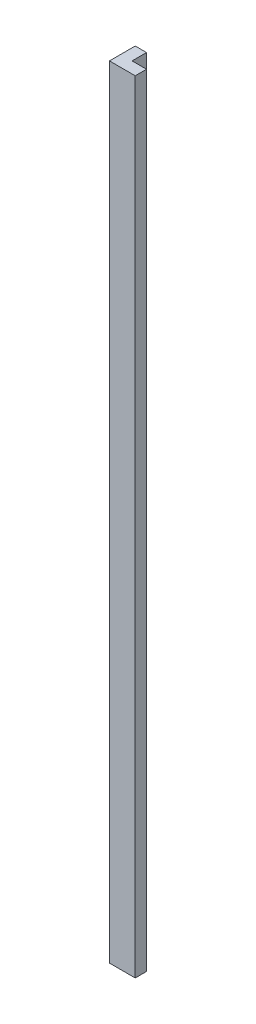
from build123d import *

# Parameters (mm, degrees)
BOSS_EXTRUDE1_DEPTH = 7023.1


with BuildPart() as part:
    # Sketch1 → Boss-Extrude1 (new body)
    with BuildSketch(Plane(origin=(0, 0, 0), x_dir=(1, 0, 0), z_dir=(0, 1, 0))):
        Polygon((0, 0), (0, 231.775), (101.6, 231.775), (101.6, 101.6), (231.775, 101.6), (231.775, 0), align=None)
    extrude(amount=BOSS_EXTRUDE1_DEPTH)


solid = part.part
